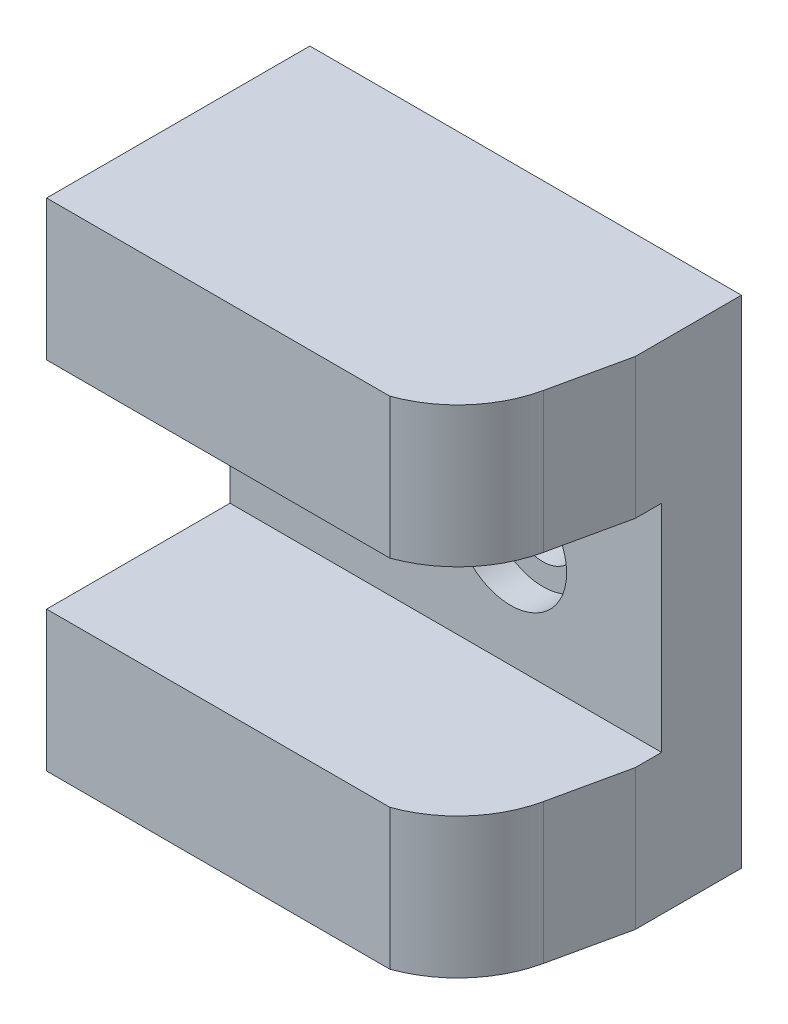
from build123d import *

# Parameters (mm, degrees)
SKETCH_1_W                   = 20
SKETCH_1_H                   = 23
EXTRUDE_1_DEPTH              = 12.2
CUT_EXTRUDE_1_DEPTH          = 26.5
SKETCH_3_W                   = 20
SKETCH_3_H                   = 10
CUT_EXTRUDE_2_DEPTH          = 8.5
HOLE_WIZARD_M3_1_D           = 3.2
HOLE_WIZARD_M3_1_CBORE_D     = 5.2
HOLE_WIZARD_M3_1_CBORE_DEPTH = 1.5


with BuildPart() as part:
    # 草图1 → 凸台-拉伸1 (new body)
    with BuildSketch(Plane.XY):
        with Locations((120, 93.5)):
            Rectangle(SKETCH_1_W, SKETCH_1_H)
    extrude(amount=EXTRUDE_1_DEPTH)

    # 草图2 → 切除-拉伸1 (cut)
    with BuildSketch(Plane(origin=(0, 105, 0), x_dir=(1, 0, 0), z_dir=(0, 1, 0))):
        with BuildLine():
            Line((129.235391925, -8.413834114), (130, -4.917427288))
            Line((130, -4.917427288), (130, -12.499168707))
            Line((130, -12.499168707), (124.353201211, -12.499168707))
            ThreePointArc((124.353201211, -12.499168707), (127.492512998, -11.290906939), (129.235391925, -8.413834114))
        make_face()
    extrude(amount=-CUT_EXTRUDE_1_DEPTH, mode=Mode.SUBTRACT)

    # 草图3 → 切除-拉伸2 (cut)
    with BuildSketch(Plane.XY.offset(12.2)):
        with Locations((120, 93.5)):
            Rectangle(SKETCH_3_W, SKETCH_3_H)
    extrude(amount=-CUT_EXTRUDE_2_DEPTH, mode=Mode.SUBTRACT)

    # M3 六角头螺栓的柱形沉头孔1 (through all)
    with Locations(Plane.XY.offset(3.7)):
        with Locations((115, 93.5), (123, 93.5)):
            CounterBoreHole(HOLE_WIZARD_M3_1_D / 2, HOLE_WIZARD_M3_1_CBORE_D / 2, HOLE_WIZARD_M3_1_CBORE_DEPTH)


solid = part.part
